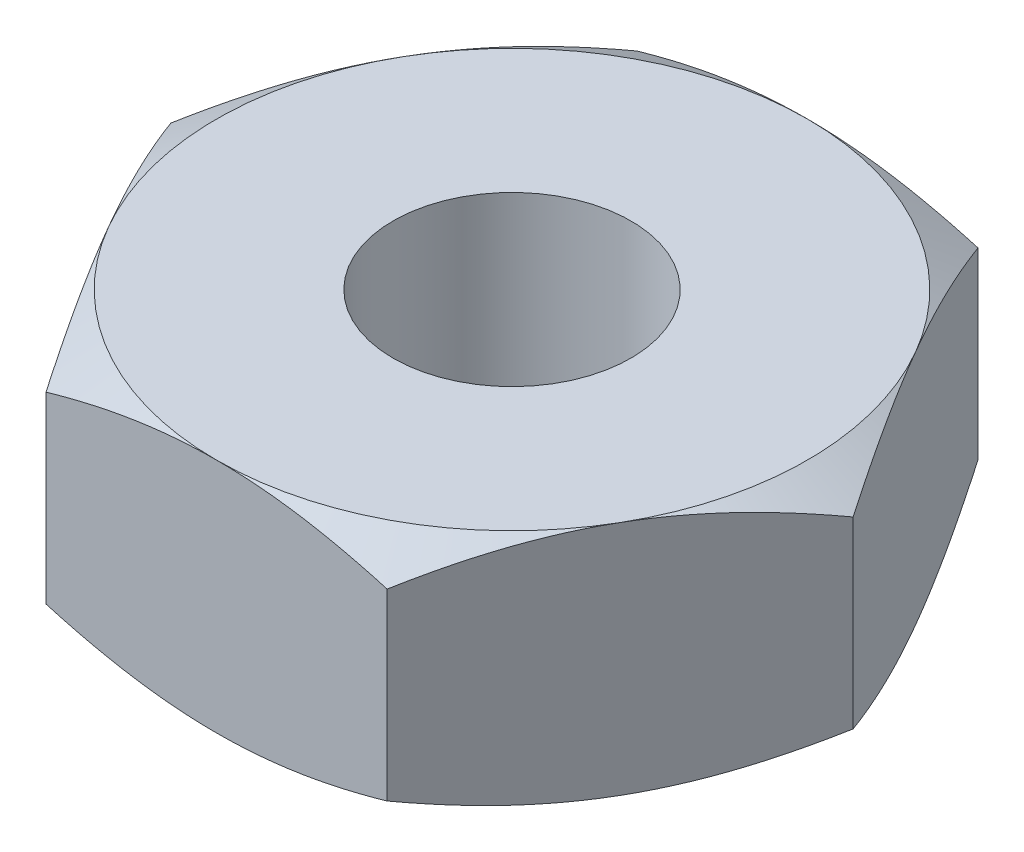
from build123d import *

# Parameters (mm, degrees)
SCHNITT_LINEAR_START            = -1e-07
SCHNITT_LINEAR_AUSTRAGEN1_DEPTH = 1.999992134


# Read off the part's stored shape, not the designer's step: Schnitt-Linear austragen1
with BuildPart() as part:
    # Skizze1 → Basis-Rotation (revolve)
    with BuildSketch(Plane.XY, mode=Mode.PRIVATE) as basis_rotation_sk:
        Polygon((1.0065, 0), (2.5, 0), (2.886751346, -0.223290994), (2.886751346, -1.776709006), (2.5, -2), (1.0065, -2), align=None)
    revolve(basis_rotation_sk.sketch.rotate(Axis((0, 0, 0), (0, -1, 0)), 90), axis=Axis((0, 0, 0), (0, -1, 0)))

    # Schnitt-Linear austragen1 outline → Schnitt-Linear austragen1 (cut)
    with BuildSketch(Plane.XZ.offset(SCHNITT_LINEAR_START)):
        with BuildLine():
            ThreePointArc((-1.443375673, -2.5), (0, -2.886751346), (1.443375673, -2.5))
            Line((1.443375673, -2.5), (-1.443375673, -2.5))
        make_face()
        with BuildLine():
            Line((2.886751346, 0), (1.443375673, -2.5))
            ThreePointArc((1.443375673, -2.5), (2.5, -1.443375673), (2.886751346, 0))
        make_face()
        with BuildLine():
            ThreePointArc((-2.886751346, 0), (-2.5, -1.443375673), (-1.443375673, -2.5))
            Line((-1.443375673, -2.5), (-2.886751346, 0))
        make_face()
        with BuildLine():
            Line((1.443375673, 2.5), (2.886751346, 0))
            ThreePointArc((2.886751346, 0), (2.5, 1.443375673), (1.443375673, 2.5))
        make_face()
        with BuildLine():
            ThreePointArc((-1.443375673, 2.5), (-2.5, 1.443375673), (-2.886751346, 0))
            Line((-2.886751346, 0), (-1.443375673, 2.5))
        make_face()
        with BuildLine():
            Line((-1.443375673, 2.5), (1.443375673, 2.5))
            ThreePointArc((1.443375673, 2.5), (0, 2.886751346), (-1.443375673, 2.5))
        make_face()
    extrude(amount=SCHNITT_LINEAR_AUSTRAGEN1_DEPTH, mode=Mode.SUBTRACT)


solid = part.part
